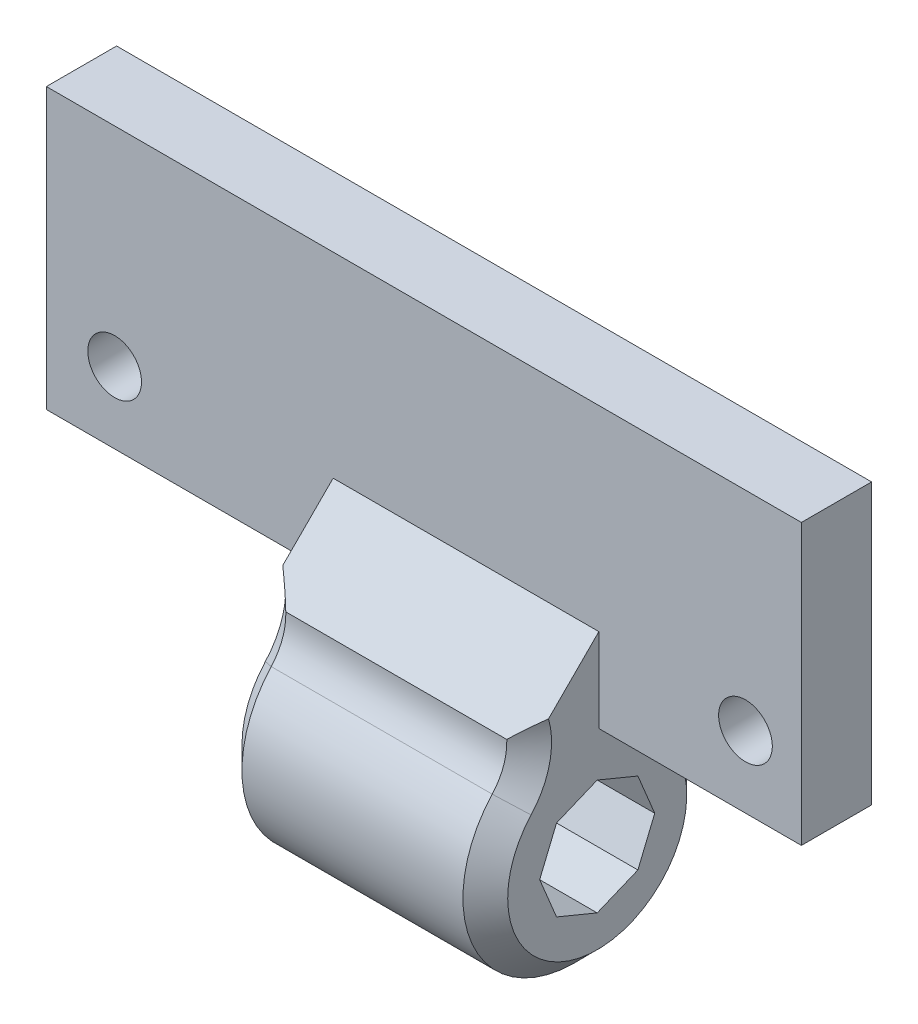
from build123d import *

# Parameters (mm, degrees)
SKETCH1_W           = 26.99
SKETCH1_H           = 10
SKETCH1_R           = 0.96
BOSS_EXTRUDE1_DEPTH = 5
SKETCH3_R           = 4
BOSS_EXTRUDE2_DEPTH = 4.75
FILLET1_R           = 2
FILLET2_R           = 2
CHAMFER1_SIZE       = 0.8
SKETCH6_W           = 3.842122027
SKETCH6_H           = 10
CUT_EXTRUDE1_DEPTH  = 41
CHAMFER3_START      = 10.25
CHAMFER3_DEPTH      = 9.5
SKETCH7_W           = 13.45
SKETCH7_H           = 4.563034457
CUT_EXTRUDE2_DEPTH  = 1
CHAMFER5_SIZE       = 1


with BuildPart() as part:
    # Sketch1 → Boss-Extrude1 (new body)
    with BuildSketch(Plane.XY):
        with Locations((13.495, 5)):
            Rectangle(SKETCH1_W, SKETCH1_H)
        with Locations((2.44, 2.55)):
            Circle(SKETCH1_R, mode=Mode.SUBTRACT)
        with Locations((24.99, 2.55)):
            Circle(SKETCH1_R, mode=Mode.SUBTRACT)
    extrude(amount=BOSS_EXTRUDE1_DEPTH)

    # Sketch3 → Boss-Extrude2 (add, symmetric)
    with BuildSketch(Plane.ZY.offset(-15)):
        with Locations((2.568998912, -3.622468738)):
            Circle(SKETCH3_R)
        Polygon((0.512453731, -3.622468738), (1.114801869, -5.076665781), (2.568998912, -5.679013919), (4.023195955, -5.076665781), (4.625544092, -3.622468738), (4.023195955, -2.168271695), (2.568998912, -1.565923558), (1.114801869, -2.168271695), align=None, mode=Mode.SUBTRACT)
    extrude(amount=BOSS_EXTRUDE2_DEPTH, both=True)

    # Fillet1
    # the kernel refuses this fillet: 2 mm, written as the material it adds along each edge
    with BuildSketch(Plane(origin=(19.75, 0, 0.872614451), x_dir=(0, 0, -1), z_dir=(-1, 0, 0))) as fillet1_piece_1:
        with BuildLine():
            CenterArc((2.851261839, -0.291469576), FILLET1_R, 139.283020083, 32.337148469)
            ThreePointArc((1.335379739, 1.013176529), (0.721358104, 0.435852839), (0, 0))
            Line((0, 0), (0.872614451, 0))
        make_face()
    extrude(amount=9.5)
    with BuildSketch(Plane(origin=(19.75, 0, 4.265383373), x_dir=(0, 0, 1), z_dir=(-1, 0, 0))) as fillet1_piece_2:
        with BuildLine():
            CenterArc((2.674069858, 0.488386288), FILLET1_R, 194.13415607, 29.112659272)
            ThreePointArc((1.217251752, -0.881898721), (0.650423795, -0.383257259), (0, 0))
            Line((0, 0), (0.734616627, 0))
        make_face()
    extrude(amount=9.5)

    # Fillet2
    # the kernel refuses this fillet: 2 mm, written as the material it adds along each edge
    with BuildSketch(Plane(origin=(19.75, 0, 0), x_dir=(0, 1, 0), z_dir=(-1, 0, 0))) as fillet2_piece_1:
        with BuildLine():
            CenterArc((0.266521997, 2), FILLET2_R, 229.596597584, 40.403402416)
            Line((-1.029808248, 0.477000363), (-1.159441272, 0.324700399))
            ThreePointArc((-1.159441272, 0.324700399), (-1.143641139, 0.311177078), (-0.029146958, -0.197864739))
            Line((-0.029146958, -0.197864739), (0, -0.2))
            Line((0, -0.2), (0.266521997, -0.2))
            Line((0.266521997, -0.2), (0.266521997, 0))
        make_face()
    extrude(amount=9.5)
    with BuildSketch(Plane(origin=(19.75, 0, 5), x_dir=(0, -0.870596677984774, 0.491997382393317), z_dir=(-1, 0, 0))) as fillet2_piece_2:
        with BuildLine():
            CenterArc((0.615688034, 1.949333304), FILLET2_R, 240.528051524, 42.396189725)
            Line((-0.368306731, 0.208139948), (-0.466706207, 0.034020613))
            Line((-0.466706207, 0.034020613), (-0.098399476, -0.174119336))
            Line((-0.098399476, -0.174119336), (-0.052901843, -0.192876631))
            ThreePointArc((-0.052901843, -0.192876631), (1.052854803, -0.20795909), (1.10774555, -0.19493333))
            Line((1.10774555, -0.19493333), (1.063013048, 0))
        make_face()
    extrude(amount=9.5)

    # Chamfer1
    # the kernel refuses this chamfer: 0.8 mm, written as the material it takes off along each edge
    with BuildSketch(Plane(origin=(19.75, 0.266521997, -2), x_dir=(0, -0.648165122631187, 0.7614998186503384), z_dir=(0, -0.7614998186503384, -0.648165122631187))) as chamfer1_piece_1_section:
        Polygon((2, CHAMFER1_SIZE), (2 + CHAMFER1_SIZE, 0), (2, 0), align=None)
    chamfer1_piece_1 = revolve(axis=Axis((19.75, 0.266521997, -2), (-1, 0, 0)), revolution_arc=99.346805501, mode=Mode.PRIVATE)
    chamfer1_piece_1 = split(chamfer1_piece_1, bisect_by=Plane(origin=(19.75, 0, -2), z_dir=(0, -1, 0)), keep=Keep.TOP, mode=Mode.PRIVATE)
    add(chamfer1_piece_1, mode=Mode.SUBTRACT)
    with BuildSketch(Plane(origin=(19.75, 0.266521997, -2), x_dir=(0, -0.648165122631187, 0.7614998186503384), z_dir=(0, -0.7614998186503384, -0.648165122631187))) as chamfer1_piece_2_section:
        Polygon((2, CHAMFER1_SIZE), (2 + CHAMFER1_SIZE, 0), (2, 0), align=None)
    chamfer1_piece_2 = revolve(axis=Axis((19.75, 0.266521997, -2), (-1, 0, 0)), revolution_arc=99.346805501, mode=Mode.PRIVATE)
    chamfer1_piece_2 = split(chamfer1_piece_2, bisect_by=Plane(origin=(19.75, 0.266521997, 0), z_dir=(0, 0, -1)), keep=Keep.TOP, mode=Mode.PRIVATE)
    add(chamfer1_piece_2, mode=Mode.SUBTRACT)
    with BuildSketch(Plane(origin=(19.75, 0.423050926, 7), x_dir=(0, 0.8566624684959867, -0.515877325602088), z_dir=(0, 0.515877325602088, 0.8566624684959867))) as chamfer1_piece_3_section:
        Polygon((2, CHAMFER1_SIZE), (2 + CHAMFER1_SIZE, 0), (2, 0), align=None)
    chamfer1_piece_3 = revolve(axis=Axis((19.75, 0.423050926, 7), (-1, 0, 0)), revolution_arc=101.340075028, mode=Mode.PRIVATE)
    chamfer1_piece_3 = split(chamfer1_piece_3, bisect_by=Plane(origin=(19.75, 0, 7), z_dir=(0, -1, 0)), keep=Keep.TOP, mode=Mode.PRIVATE)
    add(chamfer1_piece_3, mode=Mode.SUBTRACT)
    with BuildSketch(Plane(origin=(19.75, 0.423050926, 7), x_dir=(0, 0.8566624684959867, -0.515877325602088), z_dir=(0, 0.515877325602088, 0.8566624684959867))) as chamfer1_piece_4_section:
        Polygon((2, CHAMFER1_SIZE), (2 + CHAMFER1_SIZE, 0), (2, 0), align=None)
    chamfer1_piece_4 = revolve(axis=Axis((19.75, 0.423050926, 7), (-1, 0, 0)), revolution_arc=101.340075028, mode=Mode.PRIVATE)
    chamfer1_piece_4 = split(chamfer1_piece_4, bisect_by=Plane(origin=(19.75, 0.423050926, 5), z_dir=(0, 0, 1)), keep=Keep.TOP, mode=Mode.PRIVATE)
    add(chamfer1_piece_4, mode=Mode.SUBTRACT)
    with BuildSketch(Plane(origin=(19.75, -3.622468738, 2.568998912), x_dir=(0, 0.6742532774459821, 0.7385001813495726), z_dir=(0, 0.7385001813495726, -0.6742532774459821))) as chamfer1_piece_5:
        Polygon((4 - CHAMFER1_SIZE, 0), (4, -CHAMFER1_SIZE), (4, 0), align=None)
    revolve(axis=Axis((19.75, -3.622468738, 2.568998912), (1, 0, 0)), revolution_arc=262.799592141, mode=Mode.SUBTRACT)
    with BuildSketch(Plane(origin=(10.25, 0.266521997, -2), x_dir=(0, -0.648165122631187, 0.7614998186503384), z_dir=(0, -0.7614998186503384, -0.648165122631187))) as chamfer1_piece_6_section:
        Polygon((2 + CHAMFER1_SIZE, 0), (2, -CHAMFER1_SIZE), (2, 0), align=None)
    chamfer1_piece_6 = revolve(axis=Axis((10.25, 0.266521997, -2), (-1, 0, 0)), revolution_arc=99.346805501, mode=Mode.PRIVATE)
    chamfer1_piece_6 = split(chamfer1_piece_6, bisect_by=Plane(origin=(10.25, 0, -2), z_dir=(0, -1, 0)), keep=Keep.TOP, mode=Mode.PRIVATE)
    add(chamfer1_piece_6, mode=Mode.SUBTRACT)
    with BuildSketch(Plane(origin=(10.25, 0.266521997, -2), x_dir=(0, -0.648165122631187, 0.7614998186503384), z_dir=(0, -0.7614998186503384, -0.648165122631187))) as chamfer1_piece_7_section:
        Polygon((2 + CHAMFER1_SIZE, 0), (2, -CHAMFER1_SIZE), (2, 0), align=None)
    chamfer1_piece_7 = revolve(axis=Axis((10.25, 0.266521997, -2), (-1, 0, 0)), revolution_arc=99.346805501, mode=Mode.PRIVATE)
    chamfer1_piece_7 = split(chamfer1_piece_7, bisect_by=Plane(origin=(10.25, 0.266521997, 0), z_dir=(0, 0, -1)), keep=Keep.TOP, mode=Mode.PRIVATE)
    add(chamfer1_piece_7, mode=Mode.SUBTRACT)
    with BuildSketch(Plane(origin=(10.25, 0.423050926, 7), x_dir=(0, 0.8566624684959867, -0.515877325602088), z_dir=(0, 0.515877325602088, 0.8566624684959867))) as chamfer1_piece_8_section:
        Polygon((2, -CHAMFER1_SIZE), (2 + CHAMFER1_SIZE, 0), (2, 0), align=None)
    chamfer1_piece_8 = revolve(axis=Axis((10.25, 0.423050926, 7), (-1, 0, 0)), revolution_arc=101.340075028, mode=Mode.PRIVATE)
    chamfer1_piece_8 = split(chamfer1_piece_8, bisect_by=Plane(origin=(10.25, 0, 7), z_dir=(0, -1, 0)), keep=Keep.TOP, mode=Mode.PRIVATE)
    add(chamfer1_piece_8, mode=Mode.SUBTRACT)
    with BuildSketch(Plane(origin=(10.25, 0.423050926, 7), x_dir=(0, 0.8566624684959867, -0.515877325602088), z_dir=(0, 0.515877325602088, 0.8566624684959867))) as chamfer1_piece_9_section:
        Polygon((2, -CHAMFER1_SIZE), (2 + CHAMFER1_SIZE, 0), (2, 0), align=None)
    chamfer1_piece_9 = revolve(axis=Axis((10.25, 0.423050926, 7), (-1, 0, 0)), revolution_arc=101.340075028, mode=Mode.PRIVATE)
    chamfer1_piece_9 = split(chamfer1_piece_9, bisect_by=Plane(origin=(10.25, 0.423050926, 5), z_dir=(0, 0, 1)), keep=Keep.TOP, mode=Mode.PRIVATE)
    add(chamfer1_piece_9, mode=Mode.SUBTRACT)
    with BuildSketch(Plane(origin=(10.25, -3.622468738, 2.568998912), x_dir=(0, 0.6742532774459821, 0.7385001813495726), z_dir=(0, 0.7385001813495726, -0.6742532774459821))) as chamfer1_piece_10:
        Polygon((4 - CHAMFER1_SIZE, 0), (4, CHAMFER1_SIZE), (4, 0), align=None)
    revolve(axis=Axis((10.25, -3.622468738, 2.568998912), (1, 0, 0)), revolution_arc=262.799592141, mode=Mode.SUBTRACT)

    # Sketch6 → Cut-Extrude1 (cut)
    with BuildSketch(Plane(origin=(0, 0, 0), x_dir=(0, 0, -1), z_dir=(1, 0, 0))):
        with Locations((-4.430776166, 5)):
            Rectangle(SKETCH6_W, SKETCH6_H)
    extrude(amount=CUT_EXTRUDE1_DEPTH, mode=Mode.SUBTRACT)

    # Chamfer3: read off the stored shape, not the designer's step
    # Chamfer3 outline → Chamfer3 (add)
    with BuildSketch(Plane.YZ.offset(CHAMFER3_START)):
        with BuildLine():
            ThreePointArc((0.507913909, 5.001801243), (0.252566824, 5.007279455), (0, 5.045255026))
            Line((0, 5.045255026), (0, 2.509715152))
            Line((0, 2.509715152), (3, 2.509715152))
            Line((3, 2.509715152), (0.507913909, 5.001801243))
        make_face()
    extrude(amount=CHAMFER3_DEPTH)

    # Chamfer3 2 outline → Chamfer3 2 (revolve, cut)
    with BuildSketch(Plane(origin=(0, 0.423050926, 7), x_dir=(0, 1, 0), z_dir=(0, 0, -1))):
        Polygon((2, 19.75), (2, 18.95), (2.8, 19.75), align=None)
        Polygon((2.8, 10.25), (2, 11.05), (2, 10.25), align=None)
    revolve(axis=Axis((0, 0.423050926, 7), (1, 0, 0)), mode=Mode.SUBTRACT)

    # Sketch7 → Cut-Extrude2 (cut)
    with BuildSketch(Plane(origin=(0, 0, 0), x_dir=(-1, 0, 0), z_dir=(0, 0, -1))):
        with Locations((-13.715, 3.718482772)):
            Rectangle(SKETCH7_W, SKETCH7_H)
    extrude(amount=-CUT_EXTRUDE2_DEPTH, mode=Mode.SUBTRACT)

    # Chamfer5
    chamfer5_edges = [part.edges().sort_by_distance(p)[0] for p in [
        (13.715, 6, 1),
        (6.99, 3.718482772, 1),
        (13.715, 1.436965543, 1),
        (20.44, 3.718482772, 1),
    ]]
    chamfer(chamfer5_edges, length=CHAMFER5_SIZE - 0.0001)  # a hair under: the kernel refuses the full size


solid = part.part
